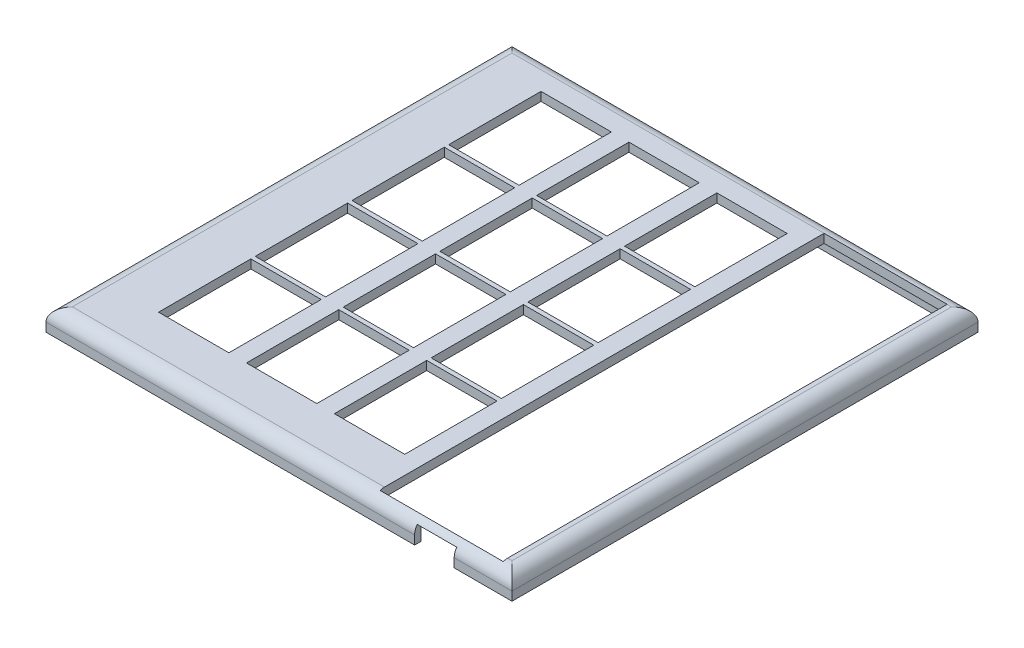
from build123d import *

# Parameters (mm, degrees)
SKETCH2_W            = 106
SKETCH2_H            = 106
BOSS_EXTRUDE3_DEPTH  = 5
SKETCH3_W            = 103
SKETCH3_H            = 103
CUT_EXTRUDE1_DEPTH   = 3
SKETCH4_W            = 9
SKETCH4_H            = 3.784346923
CUT_EXTRUDE2_DEPTH   = 10
FILLET1_R            = 3
SKETCH5_W            = 28
SKETCH5_H            = 101
CUT_EXTRUDE3_DEPTH   = 10
CUT_EXTRUDE5_DEPTH   = 2
LPATTERN1_COUNT      = 4
LPATTERN1_PITCH      = 22
LPATTERN1_COUNT_DIR2 = 3
LPATTERN1_PITCH_DIR2 = 20


with BuildPart() as part:
    # Sketch2 → Boss-Extrude3 (new body)
    with BuildSketch(Plane(origin=(0, 0, 0), x_dir=(1, 0, 0), z_dir=(0, 1, 0))):
        with Locations((48.527443435, -44.155148704)):
            Rectangle(SKETCH2_W, SKETCH2_H)
    extrude(amount=BOSS_EXTRUDE3_DEPTH)

    # Sketch3 → Cut-Extrude1 (cut)
    with BuildSketch(Plane(origin=(0, 0, 0), x_dir=(1, 0, 0), z_dir=(0, 1, 0))):
        with Locations((48.527443435, -44.155148704)):
            Rectangle(SKETCH3_W, SKETCH3_H)
    extrude(amount=CUT_EXTRUDE1_DEPTH, mode=Mode.SUBTRACT)

    # Sketch4 → Cut-Extrude2 (cut)
    with BuildSketch(Plane.XY.offset(97.155148704)):
        with Locations((83.877443435, 1.892173462)):
            Rectangle(SKETCH4_W, SKETCH4_H)
    extrude(amount=-CUT_EXTRUDE2_DEPTH, mode=Mode.SUBTRACT)

    # Fillet1
    # the kernel refuses this fillet: 3 mm, written as the material it takes off along each edge
    with BuildSketch(Plane(origin=(101.527443435, 5, -16.344851296), x_dir=(0, -1, 0), z_dir=(0, 0, 1)), Plane(origin=(-11.972556565, 5, -8.844851296), x_dir=(0, -1, 0), z_dir=(1, 0, 0)), Plane(origin=(-4.472556565, 5, 104.655148704), x_dir=(0, -1, 0), z_dir=(0, 0, -1))) as fillet1_piece_1:
        with BuildLine():
            CenterArc((FILLET1_R, -FILLET1_R), FILLET1_R, 90, 90)
            Line((0, -FILLET1_R), (0, 0))
            Line((0, 0), (FILLET1_R, 0))
        make_face()
    extrude(amount=121, mode=Mode.SUBTRACT)
    with BuildSketch(Plane(origin=(109.027443435, 5, 97.155148704), x_dir=(0, 0, -1), z_dir=(-1, 0, 0))) as fillet1_piece_2:
        with BuildLine():
            CenterArc((FILLET1_R, FILLET1_R), FILLET1_R, 180, 90)
            Line((0, FILLET1_R), (0, 0))
            Line((0, 0), (FILLET1_R, 0))
        make_face()
    extrude(amount=121, mode=Mode.SUBTRACT)

    # Sketch5 → Cut-Extrude3 (cut)
    with BuildSketch(Plane(origin=(0, 5, 0), x_dir=(1, 0, 0), z_dir=(0, 1, 0))):
        with Locations((83.527443435, -44.655148704)):
            Rectangle(SKETCH5_W, SKETCH5_H)
    extrude(amount=-CUT_EXTRUDE3_DEPTH, mode=Mode.SUBTRACT)

    # Sketch6 → Cut-Extrude5 (cut)
    with BuildSketch(Plane(origin=(0, 5, 0), x_dir=(1, 0, 0), z_dir=(0, 1, 0))):
        Polygon((49.377443435, -69.405148704), (49.377443435, -85.405148704), (65.377443435, -85.405148704), (65.377443435, -69.405148704), (65.377443435, -64.405148704), (49.377443435, -64.405148704), align=None)
    cut_extrude5 = extrude(amount=-CUT_EXTRUDE5_DEPTH, mode=Mode.SUBTRACT)

    # LPattern1: Cut-Extrude5 4 × 3
    with Locations(*[(-j * LPATTERN1_PITCH_DIR2, 0, -i * LPATTERN1_PITCH) for i in range(LPATTERN1_COUNT) for j in range(LPATTERN1_COUNT_DIR2) if (i, j) != (0, 0)]):
        add(cut_extrude5, mode=Mode.SUBTRACT)


solid = part.part
